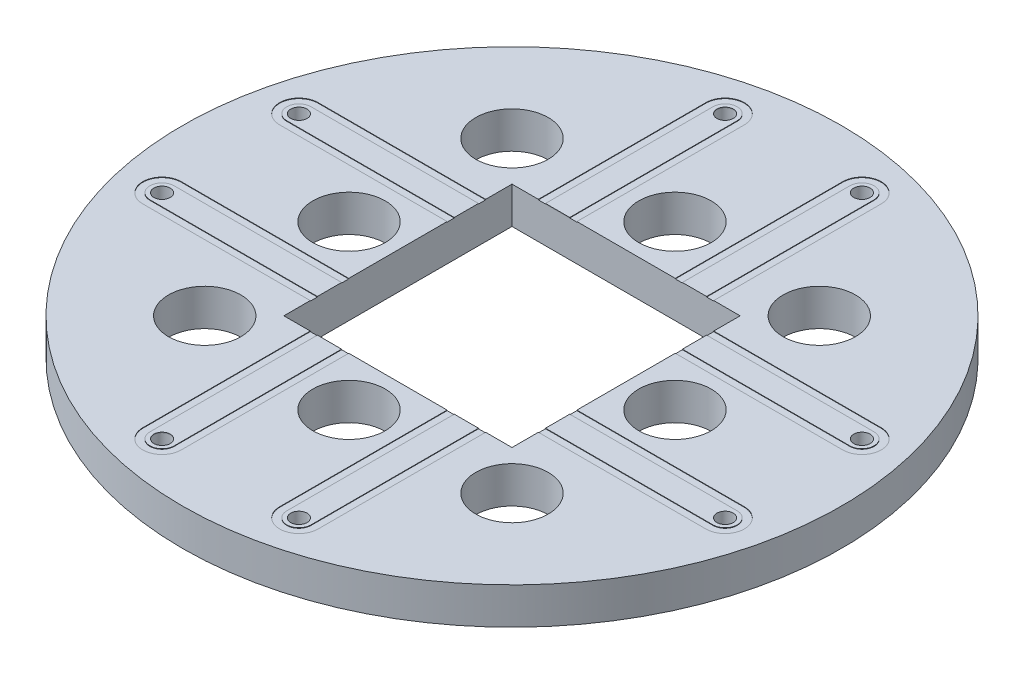
from build123d import *

# Parameters (mm, degrees)
BODAY_SKETCH_R    = 11.557
BODY_DEPTH        = 1.27
COPPER_START      = 0.017500092
COPPER_SKETCH_R   = 11.557
COPPER_DEPTH      = 0.017500092
GAP_CUT_DEPTH     = 17.39333395
CENTER_DEPTH      = 0.017500092
IO_HOLE_SKETCH_R  = 0.287000061
IO_HOLE_DEPTH     = 17.39333395
GAP_CUTS_COUNT    = 4
CENTERS_COUNT     = 4
IO_HOLES_COUNT    = 4
POCKET_DEPTH      = 17.39333395
POCKET_DEPTH_BACK = 17.39333395
POCKET_SKETCH_W   = 8.000000002
POCKET_SKETCH_H   = 8.000000002
POSTS_R           = 1.27
POST_CUT_DEPTH    = 17.39333395
POST_CUTS_COUNT   = 4


with BuildPart() as part:
    # Boday Sketch → Body (new body)
    with BuildSketch(Plane(origin=(0, 0, 0), x_dir=(1, 0, 0), z_dir=(0, 1, 0))):
        Circle(BODAY_SKETCH_R)
    extrude(amount=-BODY_DEPTH)

    # Copper Sketch → Copper (add)
    with BuildSketch(Plane(origin=(0, 0, 0), x_dir=(1, 0, 0), z_dir=(0, 1, 0)).offset(COPPER_START)):
        Circle(COPPER_SKETCH_R)
    extrude(amount=-COPPER_DEPTH)

    # Gap → Gap Cut (cut, through all)
    with BuildSketch(Plane(origin=(0, 0, 0), x_dir=(1, 0, 0), z_dir=(0, 1, 0))):
        with BuildLine():
            Line((-3.075000073, 9.872466757), (-3.075000073, -9.872466757))
            ThreePointArc((-3.075000073, -9.872466757), (-2.400000026, -10.547466804), (-1.724999979, -9.872466757))
            Line((-1.724999979, -9.872466757), (-1.724999979, 9.872466757))
            ThreePointArc((-1.724999979, 9.872466757), (-2.400000026, 10.547466804), (-3.075000073, 9.872466757))
        make_face()
    gap_cut = extrude(amount=GAP_CUT_DEPTH, mode=Mode.SUBTRACT)


with BuildPart() as body_2:
    # Center Sketch → Center (new body)
    with BuildSketch(Plane(origin=(0, 0, 0), x_dir=(1, 0, 0), z_dir=(0, 1, 0))):
        with BuildLine():
            Line((-2.825000065, 9.872466757), (-2.825000065, -9.872466757))
            ThreePointArc((-2.825000065, -9.872466757), (-2.400000026, -10.297466796), (-1.974999987, -9.872466757))
            Line((-1.974999987, -9.872466757), (-1.974999987, 9.872466757))
            ThreePointArc((-1.974999987, 9.872466757), (-2.400000026, 10.297466796), (-2.825000065, 9.872466757))
        make_face()
    center = extrude(amount=CENTER_DEPTH)


with BuildPart() as io_hole_tool:
    # IO Hole Sketch → IO Hole (new, symmetric)
    with BuildSketch(Plane(origin=(0, 0, 0), x_dir=(1, 0, 0), z_dir=(0, 1, 0))):
        with Locations((-2.400000026, 9.872466757)):
            Circle(IO_HOLE_SKETCH_R)
        with Locations((-2.400000026, -9.872466757)):
            Circle(IO_HOLE_SKETCH_R)
    io_hole = extrude(amount=IO_HOLE_DEPTH, both=True)


with BuildPart() as part_1:
    add(part.part)

    # IO Hole: cut by io_hole_tool
    add(io_hole_tool.part, mode=Mode.SUBTRACT)

    # Gap Cuts: Gap Cut ×4 about axis
    gap_cuts_axis = Axis((0, 0.0762, 0), (0, -1, 0))
    for i in range(1, GAP_CUTS_COUNT):
        add(gap_cut.rotate(gap_cuts_axis, i * 360 / GAP_CUTS_COUNT), mode=Mode.SUBTRACT)

    # Centers: Center ×4 about axis
    centers_axis = Axis((0, 0.0762, 0), (0, -1, 0))
    for i in range(1, CENTERS_COUNT):
        add(center.rotate(centers_axis, i * 360 / CENTERS_COUNT))

    # IO Holes: IO Hole ×4 about axis
    io_holes_axis = Axis((0, 0.0762, 0), (0, -1, 0))
    for i in range(1, IO_HOLES_COUNT):
        add(io_hole.rotate(io_holes_axis, i * 360 / IO_HOLES_COUNT), mode=Mode.SUBTRACT)


with BuildPart() as body_2_1:
    add(body_2.part)

    # IO Hole: cut by io_hole_tool
    add(io_hole_tool.part, mode=Mode.SUBTRACT)


with BuildPart() as pocket_tool:
    # Pocket Sketch → Pocket (new, two sides: drawn at the far end of the back side and taken through both)
    with BuildSketch(Plane(origin=(0, 0, 0), x_dir=(1, 0, 0), z_dir=(0, 1, 0)).offset(-POCKET_DEPTH_BACK)):
        Rectangle(POCKET_SKETCH_W, POCKET_SKETCH_H)
    extrude(amount=POCKET_DEPTH + POCKET_DEPTH_BACK)


with BuildPart() as part_2:
    add(part_1.part)

    # Pocket: cut by pocket_tool
    add(pocket_tool.part, mode=Mode.SUBTRACT)

    # Posts → Post Cut (cut, symmetric)
    with BuildSketch(Plane(origin=(0, 0, 0), x_dir=(1, 0, 0), z_dir=(0, 1, 0))):
        with Locations((0, 5.715)):
            Circle(POSTS_R)
        with Locations((-5.388153673, 5.388153673)):
            Circle(POSTS_R)
    post_cut = extrude(amount=POST_CUT_DEPTH, both=True, mode=Mode.SUBTRACT)

    # Post Cuts: Post Cut ×4 about axis
    post_cuts_axis = Axis((0, 0.0762, 0), (0, -1, 0))
    for i in range(1, POST_CUTS_COUNT):
        add(post_cut.rotate(post_cuts_axis, i * 360 / POST_CUTS_COUNT), mode=Mode.SUBTRACT)


with BuildPart() as body_2_2:
    add(body_2_1.part)

    # Pocket: cut by pocket_tool
    add(pocket_tool.part, mode=Mode.SUBTRACT)


solid = Compound([part_2.part, body_2_2.part])
